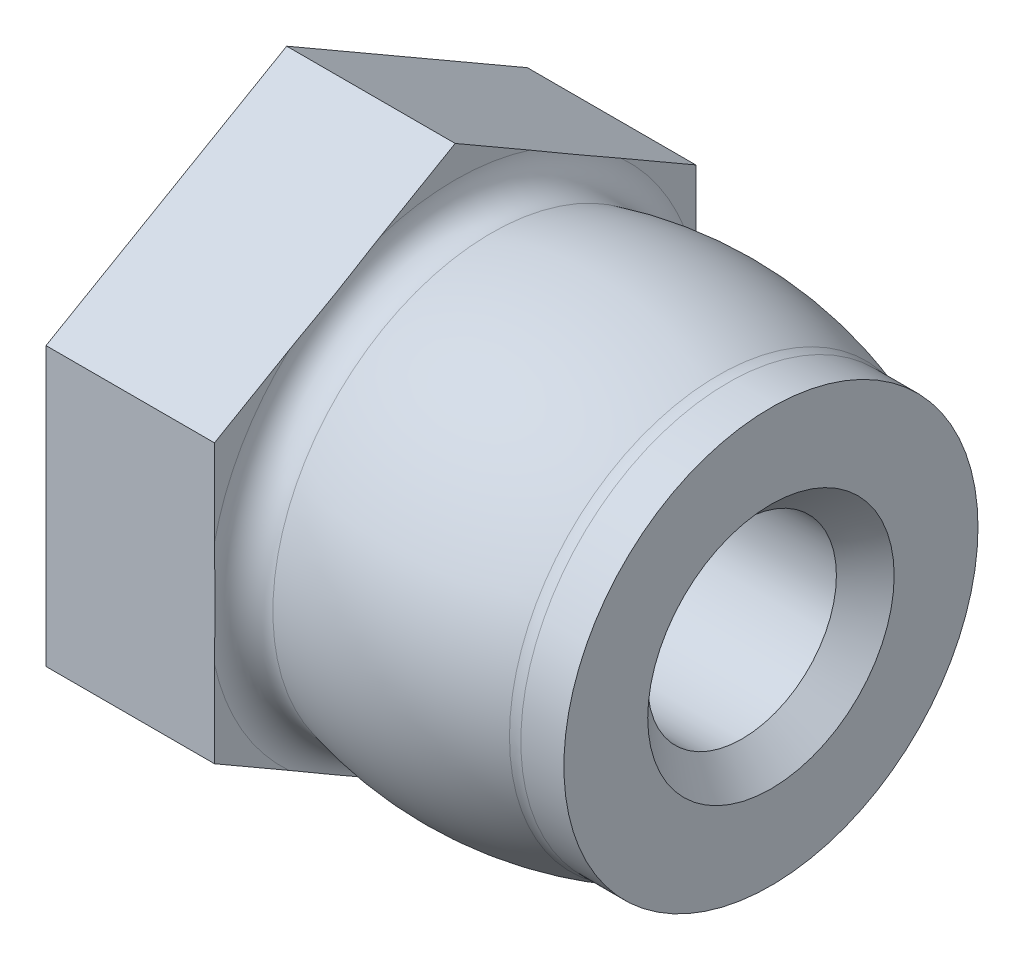
from build123d import *

# Parameters (mm, degrees)
BOSS_EXTRUDE1_START = -2.2225
SKETCH2_R           = 3.175
SKETCH2_R_2         = 1.2446
BOSS_EXTRUDE1_DEPTH = 2.2225
SKETCH3_R           = 2.731389
SKETCH3_R_2         = 1.2446
BOSS_EXTRUDE2_DEPTH = 0.635
FILLET1_R           = 0.381
FILLET2_R           = 0.381
CHAMFER1_SIZE       = 0.381


with BuildPart() as part:
    # Sketch1 → Revolve1 (revolve)
    with BuildSketch(Plane.XY, mode=Mode.PRIVATE) as revolve1_sk:
        with BuildLine():
            Line((0, 2.731389), (0, 1.2446))
            Line((0, 1.2446), (-5.7531, 1.2446))
            Line((-5.7531, 1.2446), (-5.7531, 3.175))
            Line((-5.7531, 3.175), (-3.5306, 3.175))
            Line((-3.5306, 3.175), (-3.5306, 2.731389))
            ThreePointArc((-3.5306, 2.731389), (-1.7653, 3.047974688), (0, 2.731389))
        make_face()
    revolve(revolve1_sk.sketch.rotate(Axis((-40.930080617, 0, 0), (1, 0, 0)), 90), axis=Axis((-40.930080617, 0, 0), (1, 0, 0)))

    # Sketch2 → Boss-Extrude1 (add)
    # profile 1 of 7: a face of its own
    with BuildSketch(Plane.ZY.offset(5.7531).offset(BOSS_EXTRUDE1_START)):
        with BuildLine():
            Line((1.587499954, 2.749630684), (0, 3.666174209))
            Line((0, 3.666174209), (-1.587500022, 2.749630644))
            ThreePointArc((-1.587500022, 2.749630644), (-3.9e-08, 3.175), (1.587499954, 2.749630684))
        make_face()
    # profile 2 of 7: a face of its own
    with BuildSketch(Plane.ZY.offset(5.7531).offset(BOSS_EXTRUDE1_START)):
        with BuildLine():
            ThreePointArc((-3.175, 0), (-2.749630663, 1.587499989), (-1.587500022, 2.749630644))
            Line((-1.587500022, 2.749630644), (-3.175, 1.833087105))
            Line((-3.175, 1.833087105), (-3.175, 0))
        make_face()
    # profile 3 of 7: a face of its own
    with BuildSketch(Plane.ZY.offset(5.7531).offset(BOSS_EXTRUDE1_START)):
        with BuildLine():
            ThreePointArc((-1.587499933, -2.749630696), (-2.749630638, -1.587500034), (-3.175, 0))
            Line((-3.175, 0), (-3.175, -1.833087105))
            Line((-3.175, -1.833087105), (-1.587499933, -2.749630696))
        make_face()
    # profile 4 of 7: a face of its own
    with BuildSketch(Plane.ZY.offset(5.7531).offset(BOSS_EXTRUDE1_START)):
        with BuildLine():
            ThreePointArc((1.587499954, -2.749630684), (1.2e-08, -3.175), (-1.587499933, -2.749630696))
            Line((-1.587499933, -2.749630696), (0, -3.666174209))
            Line((0, -3.666174209), (1.587499954, -2.749630684))
        make_face()
    # profile 5 of 7: a face of its own
    with BuildSketch(Plane.ZY.offset(5.7531).offset(BOSS_EXTRUDE1_START)):
        with BuildLine():
            Line((3.175, -1.833087105), (3.175, 0))
            ThreePointArc((3.175, 0), (2.749630644, -1.587500023), (1.587499954, -2.749630684))
            Line((1.587499954, -2.749630684), (3.175, -1.833087105))
        make_face()
    # profile 6 of 7: a face of its own
    with BuildSketch(Plane.ZY.offset(5.7531).offset(BOSS_EXTRUDE1_START)):
        with BuildLine():
            Line((3.175, 1.833087105), (1.587499954, 2.749630684))
            ThreePointArc((1.587499954, 2.749630684), (2.749630644, 1.587500023), (3.175, 0))
            Line((3.175, 0), (3.175, 1.833087105))
        make_face()
    # profile 7 of 7: a face of its own
    with BuildSketch(Plane.ZY.offset(5.7531).offset(BOSS_EXTRUDE1_START)):
        Circle(SKETCH2_R)
        Circle(SKETCH2_R_2, mode=Mode.SUBTRACT)
    extrude(amount=BOSS_EXTRUDE1_DEPTH)

    # Sketch3 → Boss-Extrude2 (add)
    with BuildSketch(Plane(origin=(0, 0, 0), x_dir=(0, 0, -1), z_dir=(1, 0, 0))):
        Circle(SKETCH3_R)
        with Locations(Location((0, 0, 0), (0, 0, 180))):
            Circle(SKETCH3_R_2, mode=Mode.SUBTRACT)
    extrude(amount=BOSS_EXTRUDE2_DEPTH)

    # Fillet1
    # the kernel refuses this fillet: 0.381 mm, written as the material it adds along each edge
    with BuildSketch(Plane(origin=(-3.5306, 0, 0), x_dir=(0, 0, 1), z_dir=(0, 1, 0))) as fillet1_piece_1_section:
        with BuildLine():
            CenterArc((3.250609874, 0.381), FILLET1_R, 165.315967452, 104.684032548)
            Line((3.250609874, 0), (2.731389, 0))
            ThreePointArc((2.731389, 0), (2.81260995, 0.236931857), (2.882053931, 0.47757907))
        make_face()
    fillet1_piece_1 = revolve(axis=Axis((-3.5306, 0, 0), (1, 0, 0)), mode=Mode.PRIVATE)
    fillet1_piece_1 = split(fillet1_piece_1, bisect_by=Plane(origin=(-3.388898911, -4.022914712, -0.617892675), z_dir=(0, 0.8660254037844387, -0.49999999999999994)), keep=Keep.TOP, mode=Mode.PRIVATE)
    fillet1_piece_1 = split(fillet1_piece_1, bisect_by=Plane(origin=(-3.388898911, -1.476346602, -3.792892675), z_dir=(0, 0.8660254037844389, 0.4999999999999997)), keep=Keep.TOP, mode=Mode.PRIVATE)
    fillet1_piece_1 = split(fillet1_piece_1, bisect_by=Plane(origin=(-3.388898911, 0, -3.175), z_dir=(0, 0, 1)), keep=Keep.TOP, mode=Mode.PRIVATE)
    fillet1_piece_1 = split(fillet1_piece_1, bisect_by=Plane(origin=(-3.388898911, 1.476346602, -3.792892675), z_dir=(0, -0.8660254037844386, 0.5000000000000001)), keep=Keep.TOP, mode=Mode.PRIVATE)
    fillet1_piece_1 = split(fillet1_piece_1, bisect_by=Plane(origin=(-3.388898911, 4.022914712, -0.617892675), z_dir=(0, -0.8660254037844387, -0.49999999999999983)), keep=Keep.TOP, mode=Mode.PRIVATE)
    fillet1_piece_1 = split(fillet1_piece_1, bisect_by=Plane(origin=(-3.388898911, 0, 3.175), z_dir=(0, 0, -1)), keep=Keep.TOP, mode=Mode.PRIVATE)
    add(fillet1_piece_1)

    # Fillet2
    fillet2_edges = [part.edges().sort_by_distance(p)[0] for p in [
        (0, -2.731389, 0),
    ]]
    fillet(fillet2_edges, radius=FILLET2_R)

    # Chamfer1
    chamfer1_edges = [part.edges().sort_by_distance(p)[0] for p in [
        (0.635, 0, -1.2446),
    ]]
    chamfer(chamfer1_edges, length=CHAMFER1_SIZE)


solid = part.part
